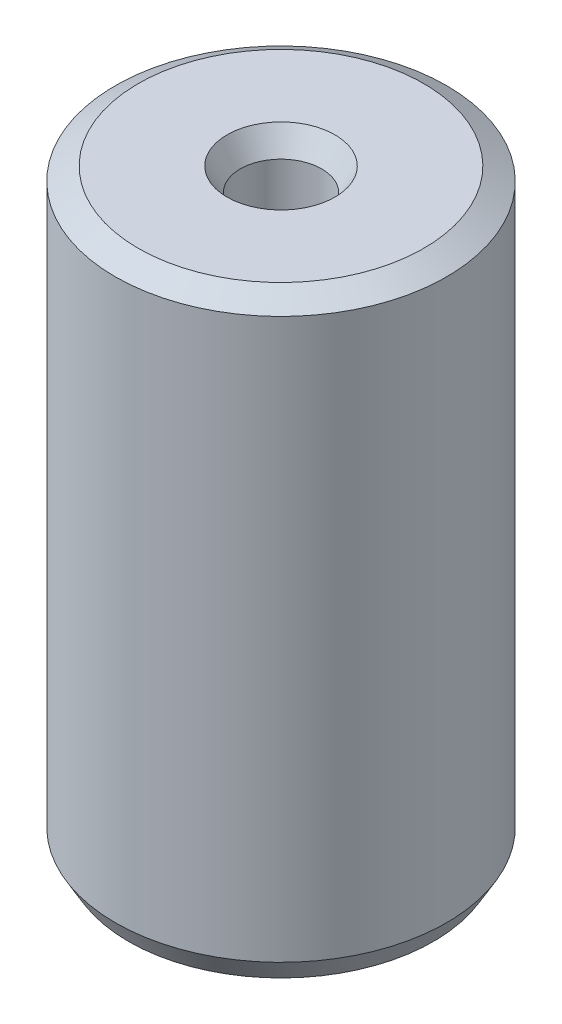
from build123d import *
from OCP.BRepFilletAPI import BRepFilletAPI_MakeChamfer

# Parameters (mm, degrees)
SKETCH1_R           = 5
BOSS_EXTRUDE1_DEPTH = 17.974928762
SKETCH2_R           = 1.229986615
CUT_EXTRUDE1_DEPTH  = 20.31574653
CHAMFER1_SIZE       = 0.398933457
CHAMFER1_SIZE2      = 0.690973017


with BuildPart() as part:
    # Sketch1 → Boss-Extrude1 (new body)
    with BuildSketch(Plane(origin=(0, 0, 0), x_dir=(1, 0, 0), z_dir=(0, 1, 0))):
        Circle(SKETCH1_R)
    extrude(amount=BOSS_EXTRUDE1_DEPTH)

    # Sketch2 → Cut-Extrude1 (cut, through all)
    with BuildSketch(Plane(origin=(0, 0, 0), x_dir=(1, 0, 0), z_dir=(0, 1, 0))):
        Circle(SKETCH2_R)
    extrude(amount=CUT_EXTRUDE1_DEPTH, mode=Mode.SUBTRACT)

    # Chamfer1: one chamfer whose edges measure the first distance from different faces: ONE call of the kernel's chamfer builder (chamfer() names one face for all edges)
    chamfer1_edges_1 = [part.edges().sort_by_distance(p)[0] for p in [
        (-1.229986615, 17.974928762, 0),
    ]]
    chamfer1_side_1 = [part.faces().sort_by_distance(p)[0] for p in [
        (-4.858578644, 17.974928762, 0),
    ]]
    chamfer1_edges_2 = [part.edges().sort_by_distance(p)[0] for p in [
        (-1.229986615, 0, 0),
    ]]
    chamfer1_side_2 = [part.faces().sort_by_distance(p)[0] for p in [
        (-1.229986615, 8.987464381, 0),
    ]]
    chamfer1_edges_3 = [part.edges().sort_by_distance(p)[0] for p in [
        (-5, 0, 0),
    ]]
    chamfer1_side_3 = [part.faces().sort_by_distance(p)[0] for p in [
        (-4.858578644, 0, 0),
    ]]
    chamfer1_edges_4 = [part.edges().sort_by_distance(p)[0] for p in [
        (-5, 17.974928762, 0),
    ]]
    chamfer1_side_4 = [part.faces().sort_by_distance(p)[0] for p in [
        (-5, 8.987464381, 0),
    ]]
    chamfer1 = BRepFilletAPI_MakeChamfer(part.part.solid().wrapped)
    for e in chamfer1_edges_1:
        chamfer1.Add(CHAMFER1_SIZE, CHAMFER1_SIZE2, e.wrapped, chamfer1_side_1[0].wrapped)  # the first distance lies on this face
    for e in chamfer1_edges_2:
        chamfer1.Add(CHAMFER1_SIZE, CHAMFER1_SIZE2, e.wrapped, chamfer1_side_2[0].wrapped)  # the first distance lies on this face
    for e in chamfer1_edges_3:
        chamfer1.Add(CHAMFER1_SIZE, CHAMFER1_SIZE2, e.wrapped, chamfer1_side_3[0].wrapped)  # the first distance lies on this face
    for e in chamfer1_edges_4:
        chamfer1.Add(CHAMFER1_SIZE, CHAMFER1_SIZE2, e.wrapped, chamfer1_side_4[0].wrapped)  # the first distance lies on this face
    add(Compound.cast(chamfer1.Shape()), mode=Mode.REPLACE)


solid = part.part
